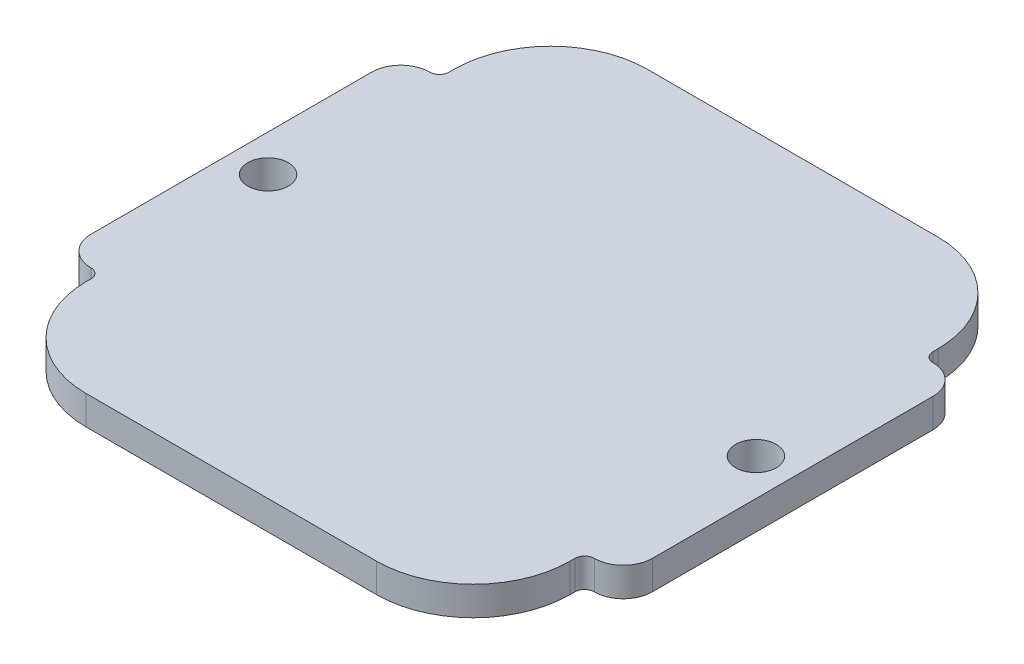
from build123d import *

# Parameters (mm, degrees)
BOSS_EXTRUDE1_DEPTH = 3
FILLET1_R           = 10
FILLET2_R           = 1
FILLET3_R           = 3
SKETCH2_R           = 2.1
CUT_EXTRUDE1_DEPTH  = 42.12177039


with BuildPart() as part:
    # Sketch1 → Boss-Extrude1 (new body)
    with BuildSketch(Plane(origin=(0, 0, 0), x_dir=(1, 0, 0), z_dir=(0, 1, 0))):
        Polygon((29, -17.5), (25, -17.5), (25, -29), (-25, -29), (-25, -17.5), (-29, -17.5), (-29, 17.5), (-25, 17.5), (-25, 29), (25, 29), (25, 17.5), (29, 17.5), align=None)
    extrude(amount=BOSS_EXTRUDE1_DEPTH)

    # Fillet1
    fillet1_edges = [part.edges().sort_by_distance(p)[0] for p in [
        (25, 1.5, 29),
        (-25, 1.5, 29),
        (-25, 1.5, -29),
        (25, 1.5, -29),
    ]]
    fillet(fillet1_edges, radius=FILLET1_R)

    # Fillet2
    fillet2_edges = [part.edges().sort_by_distance(p)[0] for p in [
        (25, 1.5, 17.5),
        (-25, 1.5, 17.5),
        (-25, 1.5, -17.5),
        (25, 1.5, -17.5),
    ]]
    fillet(fillet2_edges, radius=FILLET2_R)

    # Fillet3
    fillet3_edges = [part.edges().sort_by_distance(p)[0] for p in [
        (29, 1.5, 17.5),
        (29, 1.5, -17.5),
        (-29, 1.5, 17.5),
        (-29, 1.5, -17.5),
    ]]
    fillet(fillet3_edges, radius=FILLET3_R - 0.0001)  # a hair under: the kernel refuses the full size

    # Sketch2 → Cut-Extrude1 (cut, through all)
    with BuildSketch(Plane(origin=(0, 3, 0), x_dir=(1, 0, 0), z_dir=(0, 1, 0))):
        with Locations(Location((-25.2, 0, 0), (0, 0, 270))):
            Circle(SKETCH2_R)
        with Locations(Location((25.2, 0, 0), (0, 0, 270))):
            Circle(SKETCH2_R)
    extrude(amount=-CUT_EXTRUDE1_DEPTH, mode=Mode.SUBTRACT)


solid = part.part
